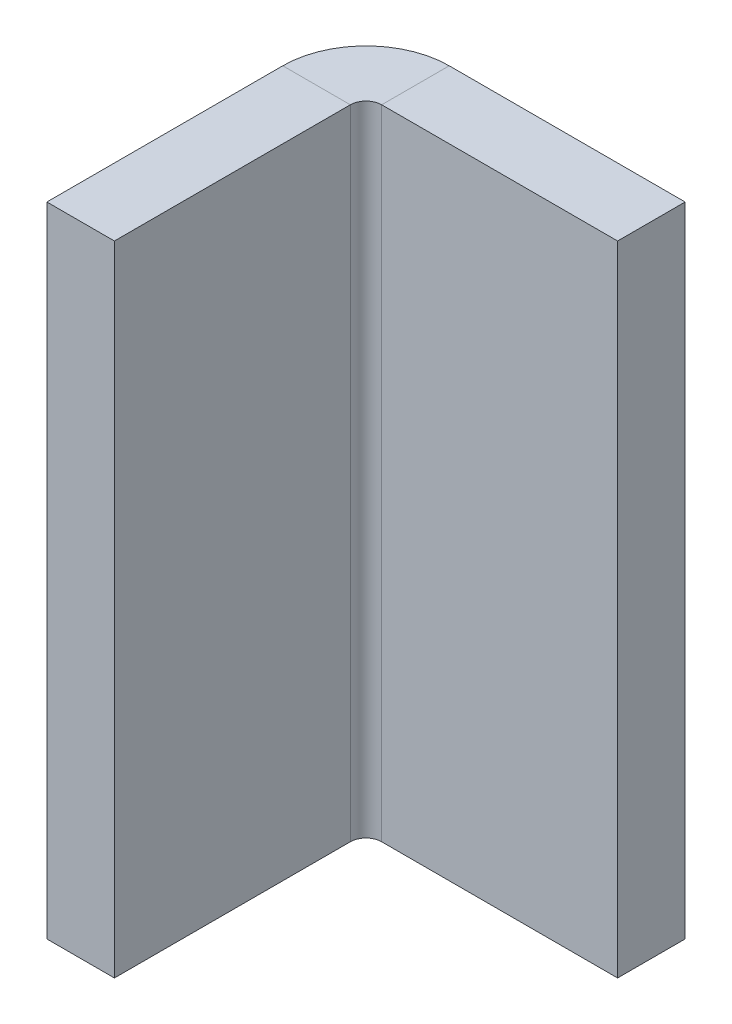
from build123d import *

# Parameters (mm, degrees)
SKETCH1_W                    = 3.175
SKETCH1_H                    = 30
BASE_FLANGE1_DEPTH           = 15
EDGE_FLANGE1_STRIP_W         = 14.1732
EDGE_FLANGE1_STRIP_H         = 3.175
EDGE_FLANGE1_STRIP_CUT_DEPTH = 30
EDGE_FLANGE1_DEPTH           = 30


# Sheet-metal steps are written as plain solids
with BuildPart() as part:
    # Sketch1 → Base-Flange1 (new body)
    with BuildSketch(Plane(origin=(0, 0, 0), x_dir=(0, 0, -1), z_dir=(1, 0, 0))):
        with Locations((1.5875, 0)):
            Rectangle(SKETCH1_W, SKETCH1_H)
    extrude(amount=BASE_FLANGE1_DEPTH)

    # Edge-Flange1 strip (across the edge) → Edge-Flange1 strip cut (cut)
    with BuildSketch(Plane.XZ.offset(-15)):
        with Locations((-3.175, -1.5875)):
            Rectangle(EDGE_FLANGE1_STRIP_W, EDGE_FLANGE1_STRIP_H)
    extrude(amount=EDGE_FLANGE1_STRIP_CUT_DEPTH, mode=Mode.SUBTRACT)

    # Edge-Flange1 section (across the edge) → Edge-Flange1 (add)
    with BuildSketch(Plane.XZ.offset(-15)):
        with BuildLine():
            Line((0, 0.7366), (0, 11.825))
            Line((0, 11.825), (3.175, 11.825))
            Line((3.175, 11.825), (3.175, 0.7366))
            ThreePointArc((3.175, 0.7366), (3.390745145, 0.215745145), (3.9116, 0))
            Line((3.9116, 0), (3.9116, -3.175))
            ThreePointArc((3.9116, -3.175), (1.145681115, -2.029318885), (0, 0.7366))
        make_face()
    extrude(amount=EDGE_FLANGE1_DEPTH)


solid = part.part
